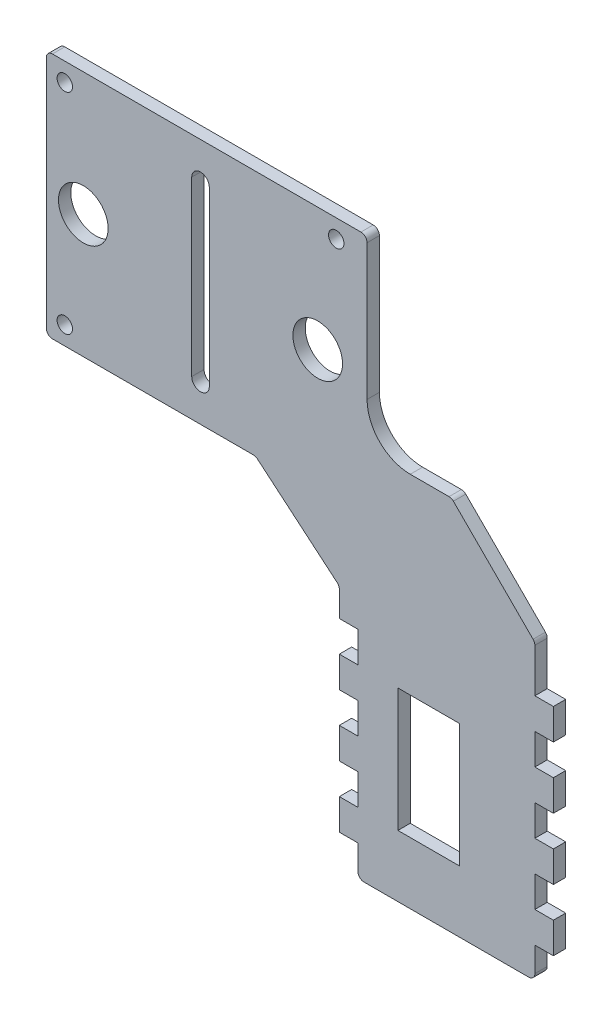
from build123d import *

# Parameters (mm, degrees)
PLATE_BODY_DEPTH          = 2
SKETCH2_R                 = 4.0238
SHAFT_BEARINGS_DEPTH      = 95.22122903
SLOT_DEPTH                = 95.22122903
SKETCH5_R                 = 1.25
BOLT_HOLES_DEPTH          = 95.22122903
SKETCH6_W                 = 0.5
SKETCH6_H                 = 40
CUT_EXTRUDE1_DEPTH        = 95.22122903
SKETCH8_W                 = 3
SKETCH8_H                 = 5
FINGER_JOINTS_DEPTH       = 2
SKETCH9_W                 = 10
SKETCH9_H                 = 20
GEAR_HOLE_DEPTH           = 97.756601842
CUT_EXTRUDE3_DEPTH        = 10
F_1MM_FILLETS_GEAR_HOLE_R = 1
F_7MM_FILLET_GEAR_HOLE_R  = 7


with BuildPart() as part:
    # Sketch1 → plate_body (new body)
    with BuildSketch(Plane.XY):
        Polygon((0, 40), (0, 0), (33.935876329, 0), (47, -11), (50, -11), (50, -51), (79.2, -51), (79.2, 10), (52, 10), (52, 40), align=None)
    extrude(amount=PLATE_BODY_DEPTH)

    # Sketch2 → shaft_bearings (cut, through all)
    with BuildSketch(Plane.XY.offset(2)):
        with Locations((6, 20)):
            Circle(SKETCH2_R)
        with Locations((44, 20)):
            Circle(SKETCH2_R)
    extrude(amount=-SHAFT_BEARINGS_DEPTH, mode=Mode.SUBTRACT)

    # Sketch4 → slot (cut, through all)
    with BuildSketch(Plane.XY.offset(2)):
        with BuildLine():
            Line((26.425, 34), (26.425, 6))
            ThreePointArc((26.425, 6), (25, 4.575), (23.575, 6))
            Line((23.575, 6), (23.575, 34))
            ThreePointArc((23.575, 34), (25, 35.425), (26.425, 34))
        make_face()
    extrude(amount=-SLOT_DEPTH, mode=Mode.SUBTRACT)

    # Sketch5 → bolt_holes (cut, through all)
    with BuildSketch(Plane.XY.offset(2)):
        with Locations((3, 37)):
            Circle(SKETCH5_R)
        with Locations((47, 37)):
            Circle(SKETCH5_R)
        with Locations((3, 3)):
            Circle(SKETCH5_R)
    extrude(amount=-BOLT_HOLES_DEPTH, mode=Mode.SUBTRACT)

    # Sketch6 → Cut-Extrude1 (cut, through all)
    with BuildSketch(Plane.XY.offset(2)):
        with Locations((50.25, -31)):
            Rectangle(SKETCH6_W, SKETCH6_H)
    extrude(amount=-CUT_EXTRUDE1_DEPTH, mode=Mode.SUBTRACT)

    # Sketch8 → finger_joints (add)
    with BuildSketch(Plane.XY.offset(2)):
        with Locations((49, -33.5)):
            Rectangle(SKETCH8_W, SKETCH8_H)
        with Locations((49, -43.5)):
            Rectangle(SKETCH8_W, SKETCH8_H)
        with Locations((80.7, -43.5)):
            Rectangle(SKETCH8_W, SKETCH8_H)
        with Locations((80.7, -33.5)):
            Rectangle(SKETCH8_W, SKETCH8_H)
        with Locations((49, -13.5)):
            Rectangle(SKETCH8_W, SKETCH8_H)
        with Locations((49, -23.5)):
            Rectangle(SKETCH8_W, SKETCH8_H)
        with Locations((80.7, -23.5)):
            Rectangle(SKETCH8_W, SKETCH8_H)
        with Locations((80.7, -13.5)):
            Rectangle(SKETCH8_W, SKETCH8_H)
    extrude(amount=-FINGER_JOINTS_DEPTH)

    # Sketch9 → gear_hole (cut, through all)
    with BuildSketch(Plane.XY.offset(2)):
        with Locations((62, -31)):
            Rectangle(SKETCH9_W, SKETCH9_H)
    extrude(amount=-GEAR_HOLE_DEPTH, mode=Mode.SUBTRACT)

    # Sketch12 → Cut-Extrude3 (cut)
    with BuildSketch(Plane.XY.offset(2)):
        Polygon((79.2, 10), (79.2, -3.5), (65.7, 10), align=None)
    extrude(amount=-CUT_EXTRUDE3_DEPTH, mode=Mode.SUBTRACT)

    # 1mm_fillets_gear_hole
    # the kernel refuses this fillet: 1 mm, written as the material it adds along each edge
    with BuildSketch(Plane(origin=(33.935876329, 0, 0), x_dir=(-1, 0, 0), z_dir=(0, 0, 1))) as f_1mm_fillets_gear_hole_piece_1:
        with BuildLine():
            CenterArc((F_1MM_FILLETS_GEAR_HOLE_R * 0.364933095837, F_1MM_FILLETS_GEAR_HOLE_R), F_1MM_FILLETS_GEAR_HOLE_R, 229.902601193, 40.097398807)
            Line((-F_1MM_FILLETS_GEAR_HOLE_R * 0.279155806295, F_1MM_FILLETS_GEAR_HOLE_R * 0.23504935705), (0, 0))
            Line((0, 0), (F_1MM_FILLETS_GEAR_HOLE_R * 0.364933095837, 0))
        make_face()
    extrude(amount=2)
    with BuildSketch(Plane(origin=(47.5, -11, 2), x_dir=(0, -1, 0), z_dir=(0, 0, -1))) as f_1mm_fillets_gear_hole_piece_2:
        with BuildLine():
            CenterArc((0.866025404, 1), F_1MM_FILLETS_GEAR_HOLE_R, 210, 60)
            Line((0, 0.5), (0, 0))
            Line((0, 0), (0.866025404, 0))
        make_face()
    extrude(amount=2)
    # the kernel refuses this fillet: 1 mm, written as the material it takes off along each edge
    with BuildSketch(Plane(origin=(0, 0, -2.5), x_dir=(0, 1, 0), z_dir=(0, 0, 1)), Plane(origin=(50.5, -51, 4.5), x_dir=(1, 0, 0), z_dir=(0, 0, -1))) as f_1mm_fillets_gear_hole_2_piece_1:
        with BuildLine():
            CenterArc((F_1MM_FILLETS_GEAR_HOLE_R, -F_1MM_FILLETS_GEAR_HOLE_R), F_1MM_FILLETS_GEAR_HOLE_R, 90, 90)
            Line((0, -F_1MM_FILLETS_GEAR_HOLE_R), (0, 0))
            Line((0, 0), (F_1MM_FILLETS_GEAR_HOLE_R, 0))
        make_face()
    extrude(amount=7, mode=Mode.SUBTRACT)
    with BuildSketch(Plane(origin=(0, 40, -2.5), x_dir=(0, -1, 0), z_dir=(0, 0, 1)), Plane(origin=(52, 40, -2.5), x_dir=(-1, 0, 0), z_dir=(0, 0, 1)), Plane(origin=(79.2, -51, -2.5), x_dir=(0, 1, 0), z_dir=(0, 0, 1))) as f_1mm_fillets_gear_hole_2_piece_2:
        with BuildLine():
            CenterArc((F_1MM_FILLETS_GEAR_HOLE_R, F_1MM_FILLETS_GEAR_HOLE_R), F_1MM_FILLETS_GEAR_HOLE_R, 180, 90)
            Line((0, F_1MM_FILLETS_GEAR_HOLE_R), (0, 0))
            Line((0, 0), (F_1MM_FILLETS_GEAR_HOLE_R, 0))
        make_face()
    extrude(amount=7, mode=Mode.SUBTRACT)
    with BuildSketch(Plane(origin=(79.2, -3.5, 3.035533906), x_dir=(-0.7071067811865523, 0.7071067811865427, 0), z_dir=(0, 0, -1)), Plane(origin=(65.7, 10, 3.035533906), x_dir=(-1, 0, 0), z_dir=(0, 0, -1))) as f_1mm_fillets_gear_hole_2_piece_3:
        with BuildLine():
            CenterArc((F_1MM_FILLETS_GEAR_HOLE_R * 0.414213562373, -F_1MM_FILLETS_GEAR_HOLE_R), F_1MM_FILLETS_GEAR_HOLE_R, 90, 45)
            Line((-F_1MM_FILLETS_GEAR_HOLE_R * 0.292893218813, -F_1MM_FILLETS_GEAR_HOLE_R * 0.292893218813), (0, 0))
            Line((0, 0), (F_1MM_FILLETS_GEAR_HOLE_R * 0.414213562373, 0))
        make_face()
    extrude(amount=4.071067812, mode=Mode.SUBTRACT)

    # 7mm_fillet_gear_hole
    f_7mm_fillet_gear_hole_edges = [part.edges().sort_by_distance(p)[0] for p in [
        (52, 10, 1),
    ]]
    fillet(f_7mm_fillet_gear_hole_edges, radius=F_7MM_FILLET_GEAR_HOLE_R)


solid = part.part
